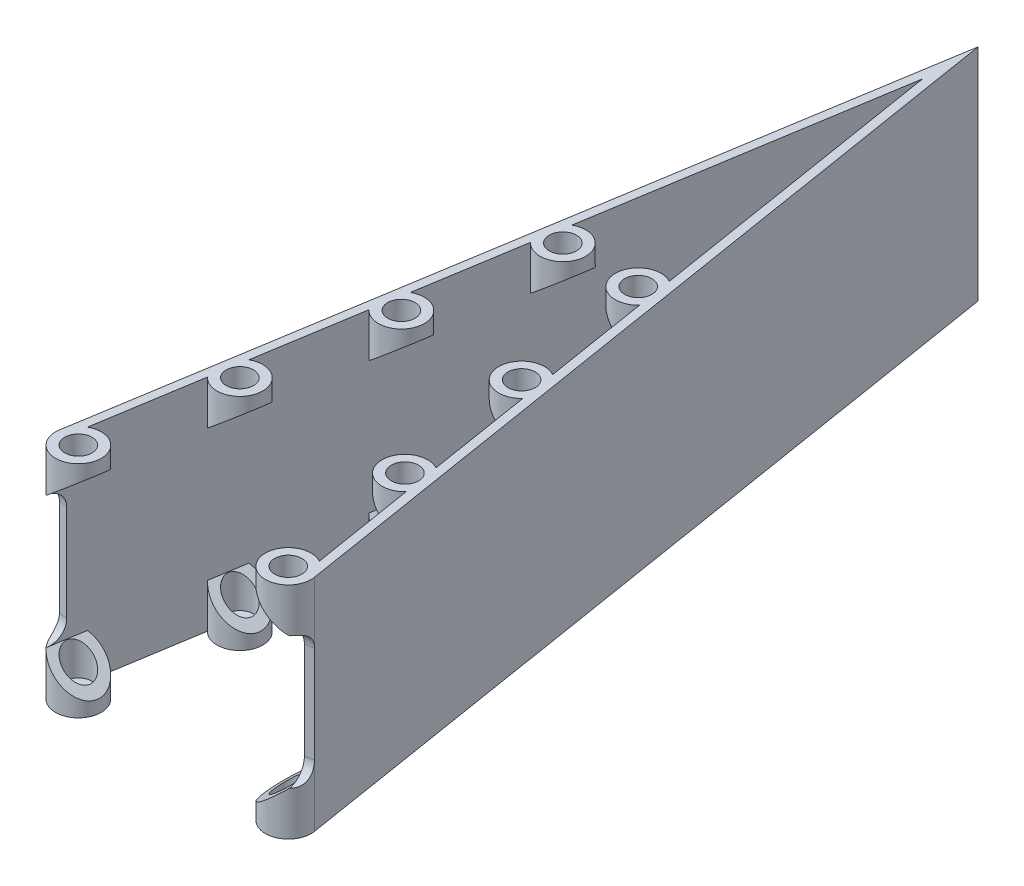
from build123d import *

# Parameters (mm, degrees)
BOSS_EXTRUDE1_DEPTH            = 25
SKETCH2_R                      = 2.6
SKETCH2_R_2                    = 1.55
BOSS_EXTRUDE3_DEPTH            = 5
CUT_EXTRUDE1_REACH             = 98.604
CUT_EXTRUDE1_DIRECTION_2_DEPTH = 97.603907966
CUT_EXTRUDE2_REACH             = 98.604
CUT_EXTRUDE2_DIRECTION_2_DEPTH = 97.603907966
FILLET1_R                      = 2
SKETCH6_R                      = 2.6
BOSS_EXTRUDE4_DEPTH            = 1


with BuildPart() as part:
    # Sketch1 → Boss-Extrude1 (new body)
    with BuildSketch(Plane(origin=(0, 0, 0), x_dir=(1, 0, 0), z_dir=(0, 1, 0))):
        Polygon((-13.5, 0), (0, 83.718518379), (13.5, 0), (14.487246657, 0.15919811), (0, 90), (-14.487246657, 0.15919811), align=None)
    extrude(amount=BOSS_EXTRUDE1_DEPTH)

    # Sketch2 → Boss-Extrude3 (add)
    # profile 1 of 8: a face of its own
    with BuildSketch(Plane(origin=(0, 0, 0), x_dir=(1, 0, 0), z_dir=(0, 1, 0))):
        with Locations((11.920405349, -0.254716975)):
            Circle(SKETCH2_R)
        with Locations(Location((11.920405349, -0.254716975, 0), (0, 0, 270))):
            Circle(SKETCH2_R_2, mode=Mode.SUBTRACT)
    # profile 2 of 8: a face of its own
    with BuildSketch(Plane(origin=(0, 0, 0), x_dir=(1, 0, 0), z_dir=(0, 1, 0))):
        with Locations((9.373235594, 15.541229537)):
            Circle(SKETCH2_R)
        with Locations(Location((9.373235594, 15.541229537, 0), (0, 0, 270))):
            Circle(SKETCH2_R_2, mode=Mode.SUBTRACT)
    # profile 3 of 8: a face of its own
    with BuildSketch(Plane(origin=(0, 0, 0), x_dir=(1, 0, 0), z_dir=(0, 1, 0))):
        with Locations((6.826065839, 31.33717605)):
            Circle(SKETCH2_R)
        with Locations(Location((6.826065839, 31.33717605, 0), (0, 0, 270))):
            Circle(SKETCH2_R_2, mode=Mode.SUBTRACT)
    # profile 4 of 8: a face of its own
    with BuildSketch(Plane(origin=(0, 0, 0), x_dir=(1, 0, 0), z_dir=(0, 1, 0))):
        with Locations((4.278896085, 47.133122563)):
            Circle(SKETCH2_R)
        with Locations(Location((4.278896085, 47.133122563, 0), (0, 0, 270))):
            Circle(SKETCH2_R_2, mode=Mode.SUBTRACT)
    # profile 5 of 8: a face of its own
    with BuildSketch(Plane(origin=(0, 0, 0), x_dir=(1, 0, 0), z_dir=(0, 1, 0))):
        with Locations((-4.278896085, 47.133122563)):
            Circle(SKETCH2_R)
        with Locations(Location((-4.278896085, 47.133122563, 0), (0, 0, 90))):
            Circle(SKETCH2_R_2, mode=Mode.SUBTRACT)
    # profile 6 of 8: a face of its own
    with BuildSketch(Plane(origin=(0, 0, 0), x_dir=(1, 0, 0), z_dir=(0, 1, 0))):
        with Locations((-6.826065839, 31.33717605)):
            Circle(SKETCH2_R)
        with Locations(Location((-6.826065839, 31.33717605, 0), (0, 0, 90))):
            Circle(SKETCH2_R_2, mode=Mode.SUBTRACT)
    # profile 7 of 8: a face of its own
    with BuildSketch(Plane(origin=(0, 0, 0), x_dir=(1, 0, 0), z_dir=(0, 1, 0))):
        with Locations((-9.373235594, 15.541229537)):
            Circle(SKETCH2_R)
        with Locations(Location((-9.373235594, 15.541229537, 0), (0, 0, 90))):
            Circle(SKETCH2_R_2, mode=Mode.SUBTRACT)
    # profile 8 of 8: a face of its own
    with BuildSketch(Plane(origin=(0, 0, 0), x_dir=(1, 0, 0), z_dir=(0, 1, 0))):
        with Locations((-11.920405349, -0.254716975)):
            Circle(SKETCH2_R)
        with Locations(Location((-11.920405349, -0.254716975, 0), (0, 0, 90))):
            Circle(SKETCH2_R_2, mode=Mode.SUBTRACT)
    boss_extrude3 = extrude(amount=BOSS_EXTRUDE3_DEPTH)

    # Cut-Extrude1: up to this face of the body (flat: up to its plane)
    cut_extrude1_end = Plane(part.part.faces().sort_by_distance((-6.667350715, 12.850191169, -42.371798131))[0])
    # Sketch4 → Cut-Extrude1 (cut, up to the picked face)
    with BuildSketch(Plane(origin=(0.342144515, 0, 2.121765321), x_dir=(0.9872466570606503, 0, -0.1591981096702188), z_dir=(0.1591981096702188, 0, 0.9872466570606503)), mode=Mode.PRIVATE) as cut_extrude1_sk1:
        Polygon((13.32782987, 5), (9.12782987, 5), (9.12782987, 1.475781549), align=None)
    cut_extrude1_tool1 = split(extrude(cut_extrude1_sk1.sketch, amount=-CUT_EXTRUDE1_REACH, mode=Mode.PRIVATE), bisect_by=cut_extrude1_end, keep=Keep.BOTH, mode=Mode.PRIVATE)
    cut_extrude1 = cut_extrude1_tool1.solids().sort_by(Axis((10.735709, 3.825261, 0.445755), (-0.1591981096702188, 0, -0.9872466570606503)))[0]
    add(cut_extrude1, mode=Mode.SUBTRACT)

    # Sketch4 → Cut-Extrude1 direction 2 (cut)
    with BuildSketch(Plane(origin=(0.342144515, 0, 2.121765321), x_dir=(0.9872466570606503, 0, -0.1591981096702188), z_dir=(0.1591981096702188, 0, 0.9872466570606503))):
        Polygon((13.32782987, 5), (9.12782987, 5), (9.12782987, 1.475781549), align=None)
    cut_extrude1_direction_2 = extrude(amount=CUT_EXTRUDE1_DIRECTION_2_DEPTH, mode=Mode.SUBTRACT)

    # Cut-Extrude2: up to this face of the body (flat: up to its plane)
    cut_extrude2_end = Plane(part.part.faces().sort_by_distance((6.667350715, 12.850191169, -42.371798131))[0])
    # Sketch5 → Cut-Extrude2 (cut, up to the picked face)
    with BuildSketch(Plane(origin=(-0.342144515, 0, 2.121765321), x_dir=(0.9872466570606502, 0, 0.15919810967021986), z_dir=(-0.15919810967021986, 0, 0.9872466570606502)), mode=Mode.PRIVATE) as cut_extrude2_sk1:
        Polygon((-9.12782987, 5), (-9.12782987, 1.475781549), (-13.32782987, 5), align=None)
    cut_extrude2_tool1 = split(extrude(cut_extrude2_sk1.sketch, amount=-CUT_EXTRUDE2_REACH, mode=Mode.PRIVATE), bisect_by=cut_extrude2_end, keep=Keep.BOTH, mode=Mode.PRIVATE)
    cut_extrude2 = cut_extrude2_tool1.solids().sort_by(Axis((-10.735709, 3.825261, 0.445755), (0.15919810967021986, 0, -0.9872466570606502)))[0]
    add(cut_extrude2, mode=Mode.SUBTRACT)

    # Sketch5 → Cut-Extrude2 direction 2 (cut)
    with BuildSketch(Plane(origin=(-0.342144515, 0, 2.121765321), x_dir=(0.9872466570606502, 0, 0.15919810967021986), z_dir=(-0.15919810967021986, 0, 0.9872466570606502))):
        Polygon((-9.12782987, 5), (-9.12782987, 1.475781549), (-13.32782987, 5), align=None)
    cut_extrude2_direction_2 = extrude(amount=CUT_EXTRUDE2_DIRECTION_2_DEPTH, mode=Mode.SUBTRACT)

    # Mirror2: Boss-Extrude3, Cut-Extrude1, Cut-Extrude1 direction 2, Cut-Extrude2, Cut-Extrude2 direction 2 across plane
    add(boss_extrude3.mirror(Plane.ZX.offset(12.5)))
    add(cut_extrude1.mirror(Plane.ZX.offset(12.5)), mode=Mode.SUBTRACT)
    add(cut_extrude1_direction_2.mirror(Plane.ZX.offset(12.5)), mode=Mode.SUBTRACT)
    add(cut_extrude2.mirror(Plane.ZX.offset(12.5)), mode=Mode.SUBTRACT)
    add(cut_extrude2_direction_2.mirror(Plane.ZX.offset(12.5)), mode=Mode.SUBTRACT)

    # Fillet1
    # the kernel refuses this fillet: 2 mm, written as the material it adds along each edge
    with BuildSketch(Plane(origin=(-19.423479942, 5, -0.955188658), x_dir=(-0.15919810967021975, 0, 0.9872466570606501), z_dir=(0.9872466570606501, 0, 0.15919810967021975))) as fillet1_piece_1_section:
        with BuildLine():
            CenterArc((FILLET1_R, -FILLET1_R), FILLET1_R, 90, 90)
            Line((0, -FILLET1_R), (0, 0))
            Line((0, 0), (FILLET1_R, 0))
        make_face()
    fillet1_piece_1 = extrude(amount=6, mode=Mode.PRIVATE)
    fillet1_piece_1 = fillet1_piece_1 & Plane(origin=(-11.920405349, 5.222362792, 0.254716975), x_dir=(1, 0, 0), z_dir=(0, -1, 0)) * Cylinder(2.6, 21, mode=Mode.PRIVATE)
    add(fillet1_piece_1)
    with BuildSketch(Plane(origin=(13.5, 5, 0), x_dir=(0, 1, 0), z_dir=(0.9872466570606502, 0, -0.15919810967021866))) as fillet1_piece_2_section:
        with BuildLine():
            CenterArc((FILLET1_R, FILLET1_R), FILLET1_R, 180, 90)
            Line((0, FILLET1_R), (0, 0))
            Line((0, 0), (FILLET1_R, 0))
        make_face()
    fillet1_piece_2 = extrude(amount=6, mode=Mode.PRIVATE)
    fillet1_piece_2 = fillet1_piece_2 & Plane(origin=(11.920405349, 5.699977741, 0.254716975), x_dir=(1, 0, 0), z_dir=(0, -1, 0)) * Cylinder(2.6, 20, mode=Mode.PRIVATE)
    add(fillet1_piece_2)
    with BuildSketch(Plane(origin=(13.5, 20, 0), x_dir=(0, -1, 0), z_dir=(0.9872466570606502, 0, -0.15919810967021866))) as fillet1_piece_3_section:
        with BuildLine():
            CenterArc((FILLET1_R, -FILLET1_R), FILLET1_R, 90, 90)
            Line((0, -FILLET1_R), (0, 0))
            Line((0, 0), (FILLET1_R, 0))
        make_face()
    fillet1_piece_3 = extrude(amount=6, mode=Mode.PRIVATE)
    fillet1_piece_3 = fillet1_piece_3 & Plane(origin=(11.920405349, 19.300022259, 0.254716975), x_dir=(1, 0, 0), z_dir=(0, 1, 0)) * Cylinder(2.6, 20, mode=Mode.PRIVATE)
    add(fillet1_piece_3)
    with BuildSketch(Plane(origin=(-19.423479942, 20, -0.955188658), x_dir=(0, -1, 0), z_dir=(0.9872466570606501, 0, 0.15919810967021975))) as fillet1_piece_4_section:
        with BuildLine():
            CenterArc((FILLET1_R, -FILLET1_R), FILLET1_R, 90, 90)
            Line((0, -FILLET1_R), (0, 0))
            Line((0, 0), (FILLET1_R, 0))
        make_face()
    fillet1_piece_4 = extrude(amount=6, mode=Mode.PRIVATE)
    fillet1_piece_4 = fillet1_piece_4 & Plane(origin=(-11.920405349, 19.777637105, 0.254716975), x_dir=(1, 0, 0), z_dir=(0, 1, 0)) * Cylinder(2.6, 21, mode=Mode.PRIVATE)
    add(fillet1_piece_4)

    # Sketch6 → Boss-Extrude4 (add)
    with BuildSketch(Plane.XZ):
        with Locations((11.920405349, 0.254716975)):
            Circle(SKETCH6_R)
        with Locations((9.373235594, -15.541229537)):
            Circle(SKETCH6_R)
        with Locations((6.826065839, -31.33717605)):
            Circle(SKETCH6_R)
        with Locations((4.278896085, -47.133122563)):
            Circle(SKETCH6_R)
        with Locations((-4.278896085, -47.133122563)):
            Circle(SKETCH6_R)
        with Locations((-6.826065839, -31.33717605)):
            Circle(SKETCH6_R)
        with Locations((-9.373235594, -15.541229537)):
            Circle(SKETCH6_R)
        with Locations((-11.920405349, 0.254716975)):
            Circle(SKETCH6_R)
    extrude(amount=-BOSS_EXTRUDE4_DEPTH)


solid = part.part
